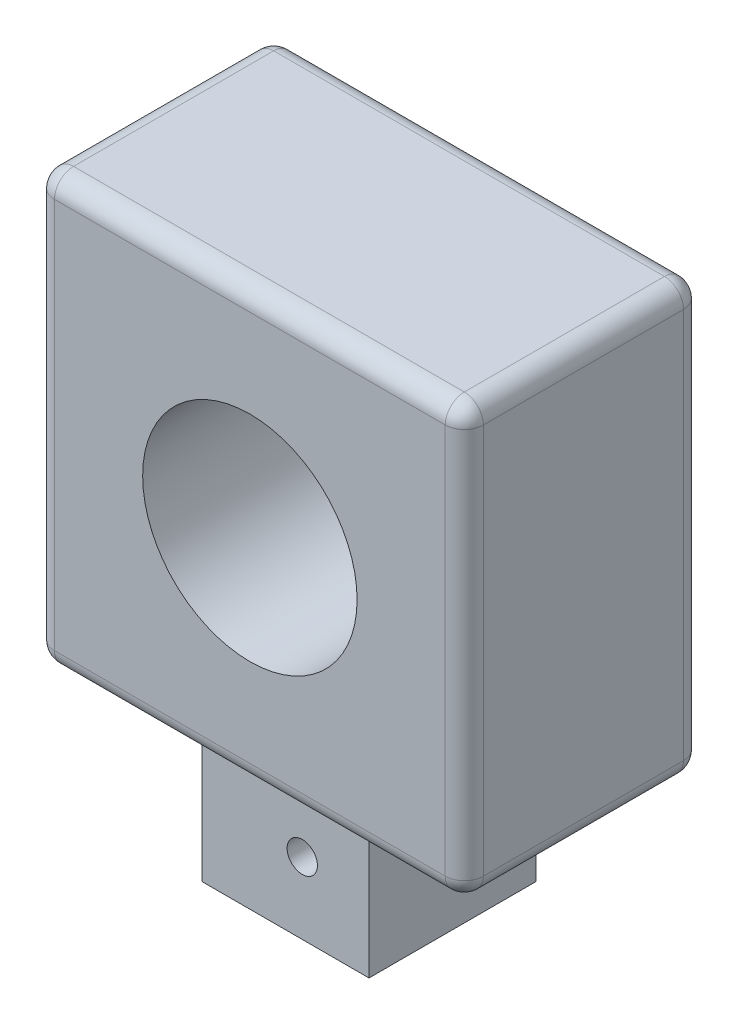
from build123d import *

# Parameters (mm, degrees)
BOSS_EXTRUDE1_DEPTH      = 12.7
BOSS_EXTRUDE1_DEPTH_BACK = 6.35
SKETCH1_W                = 22.225
SKETCH1_H                = 22.225
SKETCH2_W                = 57.15
SKETCH2_H                = 31.75
BOSS_EXTRUDE2_DEPTH      = 57.15
SKETCH3_R                = 14.2875
CUT_EXTRUDE1_DEPTH       = 82.875610685
FILLET1_R                = 2.54
SKETCH4_R                = 2.0193
CUT_EXTRUDE2_DEPTH       = 81.149100315


with BuildPart() as part:
    # Sketch1 → Boss-Extrude1 (new, two sides: drawn at the far end of the back side and taken through both)
    with BuildSketch(Plane(origin=(0, 0, 0), x_dir=(1, 0, 0), z_dir=(0, 1, 0)).offset(-BOSS_EXTRUDE1_DEPTH_BACK)):
        Rectangle(SKETCH1_W, SKETCH1_H)
    extrude(amount=BOSS_EXTRUDE1_DEPTH + BOSS_EXTRUDE1_DEPTH_BACK)

    # Sketch2 → Boss-Extrude2 (add)
    with BuildSketch(Plane(origin=(0, 12.7, 0), x_dir=(1, 0, 0), z_dir=(0, 1, 0))):
        Rectangle(SKETCH2_W, SKETCH2_H)
    extrude(amount=BOSS_EXTRUDE2_DEPTH)

    # Sketch3 → Cut-Extrude1 (cut, through all)
    with BuildSketch(Plane.XY.offset(15.875)):
        with Locations((0, 41.275)):
            Circle(SKETCH3_R)
    extrude(amount=-CUT_EXTRUDE1_DEPTH, mode=Mode.SUBTRACT)

    # Fillet1
    fillet1_edges = [part.edges().sort_by_distance(p)[0] for p in [
        (28.575, 69.85, 0),
        (28.575, 12.7, 0),
        (-28.575, 69.85, 0),
        (-28.575, 12.7, 0),
        (28.575, 41.275, -15.875),
        (0, 69.85, -15.875),
        (-28.575, 41.275, -15.875),
        (0, 12.7, -15.875),
        (-28.575, 41.275, 15.875),
        (0, 69.85, 15.875),
        (28.575, 41.275, 15.875),
        (0, 12.7, 15.875),
    ]]
    fillet(fillet1_edges, radius=FILLET1_R)

    # Sketch4 → Cut-Extrude2 (cut, through all)
    with BuildSketch(Plane(origin=(0, 0, -11.1125), x_dir=(-1, 0, 0), z_dir=(0, 0, -1))):
        with Locations((-2.2225, 3.175)):
            Circle(SKETCH4_R)
    extrude(amount=-CUT_EXTRUDE2_DEPTH, mode=Mode.SUBTRACT)


solid = part.part
